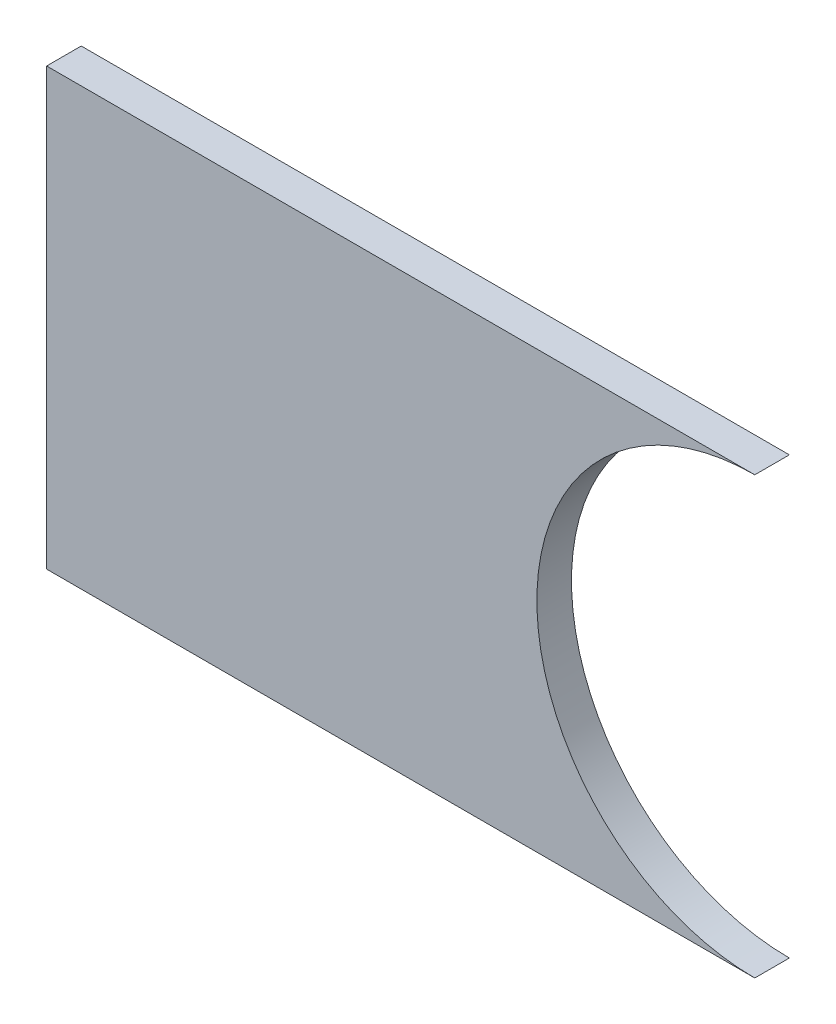
from build123d import *

# Parameters (mm, degrees)
BOSS_EXTRUDE1_DEPTH = 3.175


with BuildPart() as part:
    # Sketch1 → Boss-Extrude1 (new body)
    with BuildSketch(Plane.XY):
        with BuildLine():
            Line((0, 0), (65, 0))
            ThreePointArc((65, 0), (45, 20), (65, 40))
            Line((65, 40), (0, 40))
            Line((0, 40), (0, 0))
        make_face()
    extrude(amount=BOSS_EXTRUDE1_DEPTH)


solid = part.part
